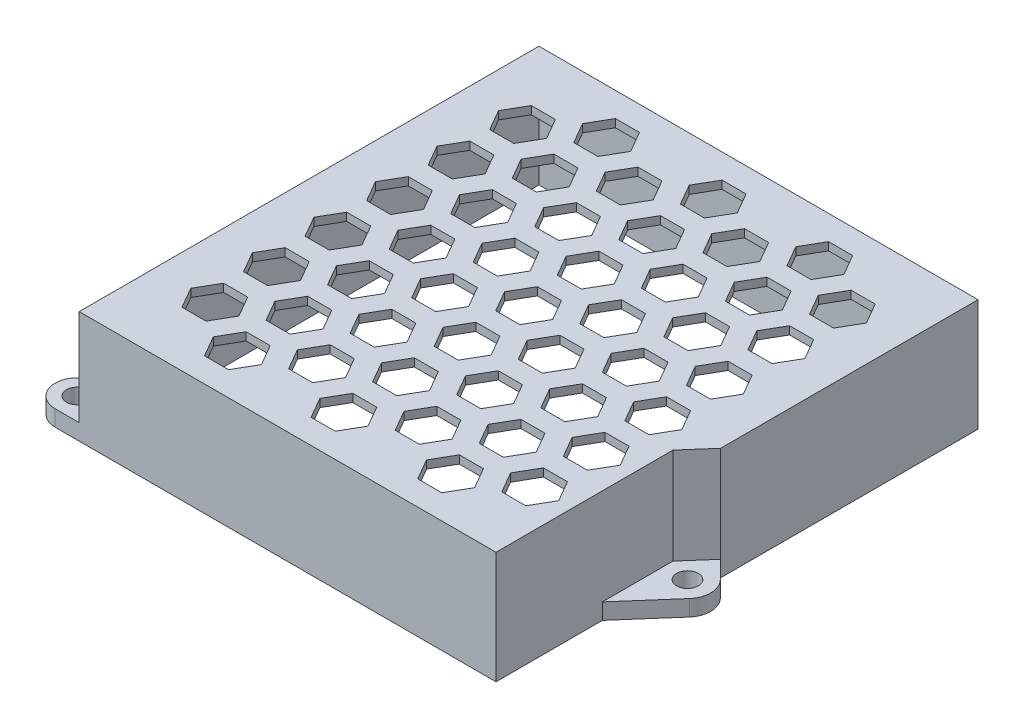
from build123d import *

# Parameters (mm, degrees)
BOSS_EXTRUDE1_DEPTH   = 1.5875
BOSS_EXTRUDE2_DEPTH   = 20.6375
FILL_PATTERN1_DEPTH   = 1.5875
BOSS_EXTRUDE3_DEPTH   = 3.175
F_6_CLEARANCE_HOLE1_D = 4.3053


# Read off the part's stored shape, not the designer's step: Fill Pattern1
with BuildPart() as part:
    # Sketch1 → Boss-Extrude1 (new body)
    with BuildSketch(Plane(origin=(0, 0, 0), x_dir=(1, 0, 0), z_dir=(0, 1, 0))):
        Polygon((-3.175, 87.8992), (-3.175, -3.175), (79.3953, -3.175), (79.3953, 31.877838461), (83.8047, 36.917138461), (83.8047, 87.8992), align=None)
    extrude(amount=BOSS_EXTRUDE1_DEPTH)

    # Sketch10 → Boss-Extrude2 (add)
    with BuildSketch(Plane.XZ):
        Polygon((-3.175, -87.8992), (83.8047, -87.8992), (83.8047, -36.917138461), (79.3953, -31.877838461), (79.3953, 3.175), (-3.175, 3.175), align=None)
        Polygon((-1.5875, -86.3117), (82.2172, -86.3117), (82.2172, -37.513619231), (77.8078, -32.474319231), (77.8078, 1.5875), (-1.5875, 1.5875), align=None, mode=Mode.SUBTRACT)
    extrude(amount=BOSS_EXTRUDE2_DEPTH)

    # Fill Pattern1 outline → Fill Pattern1 (cut)
    with BuildSketch(Plane(origin=(0, 0, 0), x_dir=(1, 0, 0), z_dir=(0, 1, 0))):
        Polygon((63.813263446, 74.813654014), (66.194513446, 78.9381), (63.813263446, 83.062545986), (59.050763446, 83.062545986), (56.669513446, 78.9381), (59.050763446, 74.813654014), align=None)
        Polygon((53.254681723, 56.525654014), (55.635931723, 60.6501), (53.254681723, 64.774545986), (48.492181723, 64.774545986), (46.110931723, 60.6501), (48.492181723, 56.525654014), align=None)
        Polygon((42.6961, 38.237654014), (45.07735, 42.3621), (42.6961, 46.486545986), (37.9336, 46.486545986), (35.55235, 42.3621), (37.9336, 38.237654014), align=None)
        Polygon((21.578936554, 1.661654014), (23.960186554, 5.7861), (21.578936554, 9.910545986), (16.816436554, 9.910545986), (14.435186554, 5.7861), (16.816436554, 1.661654014), align=None)
        Polygon((32.137518277, 19.949654014), (34.518768277, 24.0741), (32.137518277, 28.198545986), (27.375018277, 28.198545986), (24.993768277, 24.0741), (27.375018277, 19.949654014), align=None)
        Polygon((76.753095169, 60.6501), (74.371845169, 64.774545986), (69.609345169, 64.774545986), (67.228095169, 60.6501), (69.609345169, 56.525654014), (74.371845169, 56.525654014), align=None)
        Polygon((21.578936554, 83.062545986), (16.816436554, 83.062545986), (14.435186554, 78.9381), (16.816436554, 74.813654014), (21.578936554, 74.813654014), (23.960186554, 78.9381), align=None)
        Polygon((42.6961, 83.062545986), (37.9336, 83.062545986), (35.55235, 78.9381), (37.9336, 74.813654014), (42.6961, 74.813654014), (45.07735, 78.9381), align=None)
        Polygon((53.254681723, 44.333654014), (55.635931723, 48.4581), (53.254681723, 52.582545986), (48.492181723, 52.582545986), (46.110931723, 48.4581), (48.492181723, 44.333654014), align=None)
        Polygon((42.6961, 26.045654014), (45.07735, 30.1701), (42.6961, 34.294545986), (37.9336, 34.294545986), (35.55235, 30.1701), (37.9336, 26.045654014), align=None)
        Polygon((63.813263446, 62.621654014), (66.194513446, 66.7461), (63.813263446, 70.870545986), (59.050763446, 70.870545986), (56.669513446, 66.7461), (59.050763446, 62.621654014), align=None)
        Polygon((32.137518277, 7.757654014), (34.518768277, 11.8821), (32.137518277, 16.006545986), (27.375018277, 16.006545986), (24.993768277, 11.8821), (27.375018277, 7.757654014), align=None)
        Polygon((66.194513446, 30.1701), (63.813263446, 34.294545986), (59.050763446, 34.294545986), (56.669513446, 30.1701), (59.050763446, 26.045654014), (63.813263446, 26.045654014), align=None)
        Polygon((76.753095169, 11.8821), (74.371845169, 16.006545986), (69.609345169, 16.006545986), (67.228095169, 11.8821), (69.609345169, 7.757654014), (74.371845169, 7.757654014), align=None)
        Polygon((45.07735, 66.7461), (42.6961, 70.870545986), (37.9336, 70.870545986), (35.55235, 66.7461), (37.9336, 62.621654014), (42.6961, 62.621654014), align=None)
        Polygon((74.371845169, 52.582545986), (69.609345169, 52.582545986), (67.228095169, 48.4581), (69.609345169, 44.333654014), (74.371845169, 44.333654014), (76.753095169, 48.4581), align=None)
        Polygon((11.020354831, 52.582545986), (6.257854831, 52.582545986), (3.876604831, 48.4581), (6.257854831, 44.333654014), (11.020354831, 44.333654014), (13.401604831, 48.4581), align=None)
        Polygon((32.137518277, 52.582545986), (27.375018277, 52.582545986), (24.993768277, 48.4581), (27.375018277, 44.333654014), (32.137518277, 44.333654014), (34.518768277, 48.4581), align=None)
        Polygon((53.254681723, 32.141654014), (55.635931723, 36.2661), (53.254681723, 40.390545986), (48.492181723, 40.390545986), (46.110931723, 36.2661), (48.492181723, 32.141654014), align=None)
        Polygon((74.371845169, 68.717654014), (76.753095169, 72.8421), (74.371845169, 76.966545986), (69.609345169, 76.966545986), (67.228095169, 72.8421), (69.609345169, 68.717654014), align=None)
        Polygon((63.813263446, 50.429654014), (66.194513446, 54.5541), (63.813263446, 58.678545986), (59.050763446, 58.678545986), (56.669513446, 54.5541), (59.050763446, 50.429654014), align=None)
        Polygon((42.6961, 13.853654014), (45.07735, 17.9781), (42.6961, 22.102545986), (37.9336, 22.102545986), (35.55235, 17.9781), (37.9336, 13.853654014), align=None)
        Polygon((66.194513446, 17.9781), (63.813263446, 22.102545986), (59.050763446, 22.102545986), (56.669513446, 17.9781), (59.050763446, 13.853654014), (63.813263446, 13.853654014), align=None)
        Polygon((34.518768277, 72.8421), (32.137518277, 76.966545986), (27.375018277, 76.966545986), (24.993768277, 72.8421), (27.375018277, 68.717654014), (32.137518277, 68.717654014), align=None)
        Polygon((45.07735, 54.5541), (42.6961, 58.678545986), (37.9336, 58.678545986), (35.55235, 54.5541), (37.9336, 50.429654014), (42.6961, 50.429654014), align=None)
        Polygon((74.371845169, 40.390545986), (69.609345169, 40.390545986), (67.228095169, 36.2661), (69.609345169, 32.141654014), (74.371845169, 32.141654014), (76.753095169, 36.2661), align=None)
        Polygon((11.020354831, 40.390545986), (6.257854831, 40.390545986), (3.876604831, 36.2661), (6.257854831, 32.141654014), (11.020354831, 32.141654014), (13.401604831, 36.2661), align=None)
        Polygon((32.137518277, 40.390545986), (27.375018277, 40.390545986), (24.993768277, 36.2661), (27.375018277, 32.141654014), (32.137518277, 32.141654014), (34.518768277, 36.2661), align=None)
        Polygon((53.254681723, 19.949654014), (55.635931723, 24.0741), (53.254681723, 28.198545986), (48.492181723, 28.198545986), (46.110931723, 24.0741), (48.492181723, 19.949654014), align=None)
        Polygon((63.813263446, 38.237654014), (66.194513446, 42.3621), (63.813263446, 46.486545986), (59.050763446, 46.486545986), (56.669513446, 42.3621), (59.050763446, 38.237654014), align=None)
        Polygon((42.6961, 1.661654014), (45.07735, 5.7861), (42.6961, 9.910545986), (37.9336, 9.910545986), (35.55235, 5.7861), (37.9336, 1.661654014), align=None)
        Polygon((66.194513446, 5.7861), (63.813263446, 9.910545986), (59.050763446, 9.910545986), (56.669513446, 5.7861), (59.050763446, 1.661654014), (63.813263446, 1.661654014), align=None)
        Polygon((34.518768277, 60.6501), (32.137518277, 64.774545986), (27.375018277, 64.774545986), (24.993768277, 60.6501), (27.375018277, 56.525654014), (32.137518277, 56.525654014), align=None)
        Polygon((74.371845169, 28.198545986), (69.609345169, 28.198545986), (67.228095169, 24.0741), (69.609345169, 19.949654014), (74.371845169, 19.949654014), (76.753095169, 24.0741), align=None)
        Polygon((11.020354831, 28.198545986), (6.257854831, 28.198545986), (3.876604831, 24.0741), (6.257854831, 19.949654014), (11.020354831, 19.949654014), (13.401604831, 24.0741), align=None)
        Polygon((53.254681723, 7.757654014), (55.635931723, 11.8821), (53.254681723, 16.006545986), (48.492181723, 16.006545986), (46.110931723, 11.8821), (48.492181723, 7.757654014), align=None)
        Polygon((23.960186554, 66.7461), (21.578936554, 70.870545986), (16.816436554, 70.870545986), (14.435186554, 66.7461), (16.816436554, 62.621654014), (21.578936554, 62.621654014), align=None)
        Polygon((11.020354831, 16.006545986), (6.257854831, 16.006545986), (3.876604831, 11.8821), (6.257854831, 7.757654014), (11.020354831, 7.757654014), (13.401604831, 11.8821), align=None)
        Polygon((21.578936554, 46.486545986), (16.816436554, 46.486545986), (14.435186554, 42.3621), (16.816436554, 38.237654014), (21.578936554, 38.237654014), (23.960186554, 42.3621), align=None)
        Polygon((21.578936554, 34.294545986), (16.816436554, 34.294545986), (14.435186554, 30.1701), (16.816436554, 26.045654014), (21.578936554, 26.045654014), (23.960186554, 30.1701), align=None)
        Polygon((21.578936554, 22.102545986), (16.816436554, 22.102545986), (14.435186554, 17.9781), (16.816436554, 13.853654014), (21.578936554, 13.853654014), (23.960186554, 17.9781), align=None)
        Polygon((55.635931723, 72.8421), (53.254681723, 76.966545986), (48.492181723, 76.966545986), (46.110931723, 72.8421), (48.492181723, 68.717654014), (53.254681723, 68.717654014), align=None)
        Polygon((13.401604831, 60.6501), (11.020354831, 64.774545986), (6.257854831, 64.774545986), (3.876604831, 60.6501), (6.257854831, 56.525654014), (11.020354831, 56.525654014), align=None)
        Polygon((21.578936554, 50.429654014), (23.960186554, 54.5541), (21.578936554, 58.678545986), (16.816436554, 58.678545986), (14.435186554, 54.5541), (16.816436554, 50.429654014), align=None)
        Polygon((13.401604831, 72.8421), (11.020354831, 76.966545986), (6.257854831, 76.966545986), (3.876604831, 72.8421), (6.257854831, 68.717654014), (11.020354831, 68.717654014), align=None)
    extrude(amount=FILL_PATTERN1_DEPTH, mode=Mode.SUBTRACT)

    # Sketch11 → Boss-Extrude3 (add)
    with BuildSketch(Plane.XZ.offset(20.6375)):
        with BuildLine():
            Line((83.8047, -36.917138461), (87.28407409, -33.373432701))
            ThreePointArc((87.28407409, -33.373432701), (88.600903638, -30.280169774), (87.463720699, -27.116448774))
            Line((87.463720699, -27.116448774), (79.3953, -17.895422687))
            Line((79.3953, -17.895422687), (79.3953, -31.877838461))
            Line((79.3953, -31.877838461), (83.8047, -36.917138461))
        make_face()
        with BuildLine():
            Line((-3.175, 3.175), (-7.9375, 3.175))
            ThreePointArc((-7.9375, 3.175), (-12.340209, -1.227709), (-7.9375, -5.630418))
            Line((-7.9375, -5.630418), (-3.175, -5.630418))
            Line((-3.175, -5.630418), (-3.175, 3.175))
        make_face()
        with BuildLine():
            Line((-3.175, -87.8992), (-7.9375, -87.8992))
            ThreePointArc((-7.9375, -87.8992), (-12.559411, -83.277289), (-7.9375, -78.655378))
            Line((-7.9375, -78.655378), (-3.175, -78.655378))
            Line((-3.175, -78.655378), (-3.175, -87.8992))
        make_face()
    extrude(amount=-BOSS_EXTRUDE3_DEPTH)

    # #6 Clearance Hole1 (through all)
    with Locations(Plane(origin=(0, -17.4625, 0), x_dir=(1, 0, 0), z_dir=(0, 1, 0))):
        with Locations((-7.9375, 83.277289), (-7.9375, 1.227709), (83.99905, 30.14804423)):
            Hole(F_6_CLEARANCE_HOLE1_D / 2)


solid = part.part
